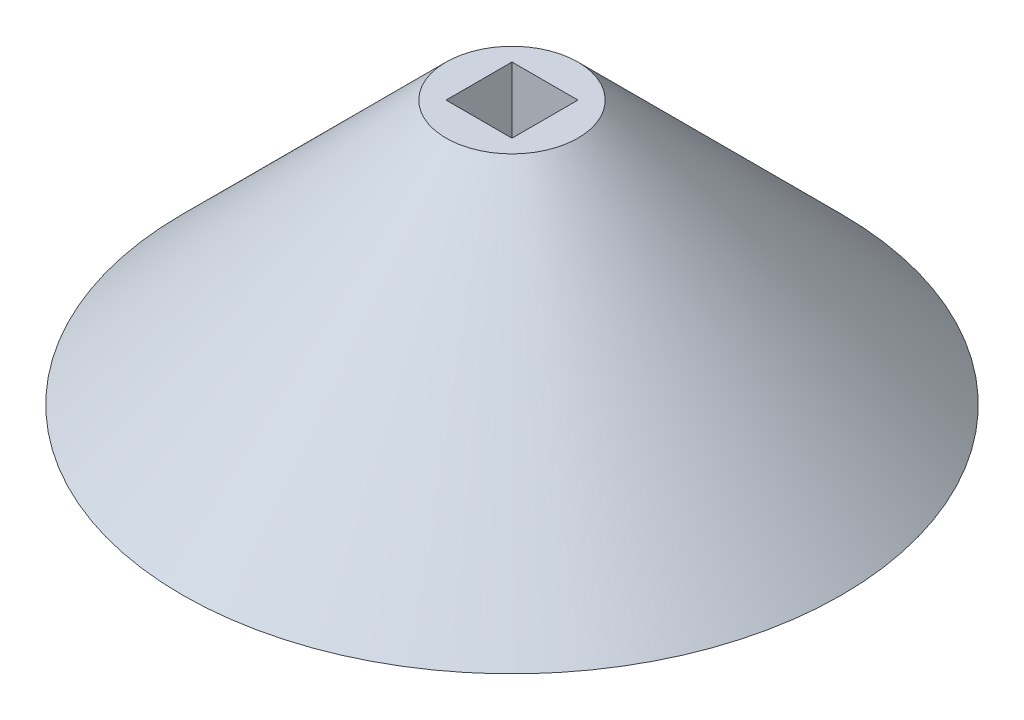
from build123d import *

# Parameters (mm, degrees)
SKETCH2_R          = 1.5
CUT_EXTRUDE1_DEPTH = 41.620192023
CUT_EXTRUDE2_START = 10
SKETCH3_W          = 5
SKETCH3_H          = 5
CUT_EXTRUDE2_DEPTH = 31.620192023
SKETCH4_R          = 13.1
CUT_EXTRUDE3_DEPTH = 7.9


with BuildPart() as part:
    # Sketch1 → Revolve1 (revolve)
    with BuildSketch(Plane(origin=(0, 0, 0), x_dir=(0, 0, -1), z_dir=(1, 0, 0))):
        Polygon((0, 0), (25, 0), (5, 20), (0, 20), align=None)
    revolve(axis=Axis((0, 0, 0), (0, 1, 0)))

    # Sketch2 → Cut-Extrude1 (cut, through all)
    with BuildSketch(Plane(origin=(0, 0, 0), x_dir=(1, 0, 0), z_dir=(0, 1, 0))):
        Circle(SKETCH2_R)
    extrude(amount=CUT_EXTRUDE1_DEPTH, mode=Mode.SUBTRACT)

    # Sketch3 → Cut-Extrude2 (cut, through all)
    with BuildSketch(Plane(origin=(0, 0, 0), x_dir=(1, 0, 0), z_dir=(0, 1, 0)).offset(CUT_EXTRUDE2_START)):
        Rectangle(SKETCH3_W, SKETCH3_H)
    extrude(amount=CUT_EXTRUDE2_DEPTH, mode=Mode.SUBTRACT)

    # Sketch4 → Cut-Extrude3 (cut)
    with BuildSketch(Plane(origin=(0, 0, 0), x_dir=(1, 0, 0), z_dir=(0, 1, 0))):
        Circle(SKETCH4_R)
    extrude(amount=CUT_EXTRUDE3_DEPTH, mode=Mode.SUBTRACT)


solid = part.part
